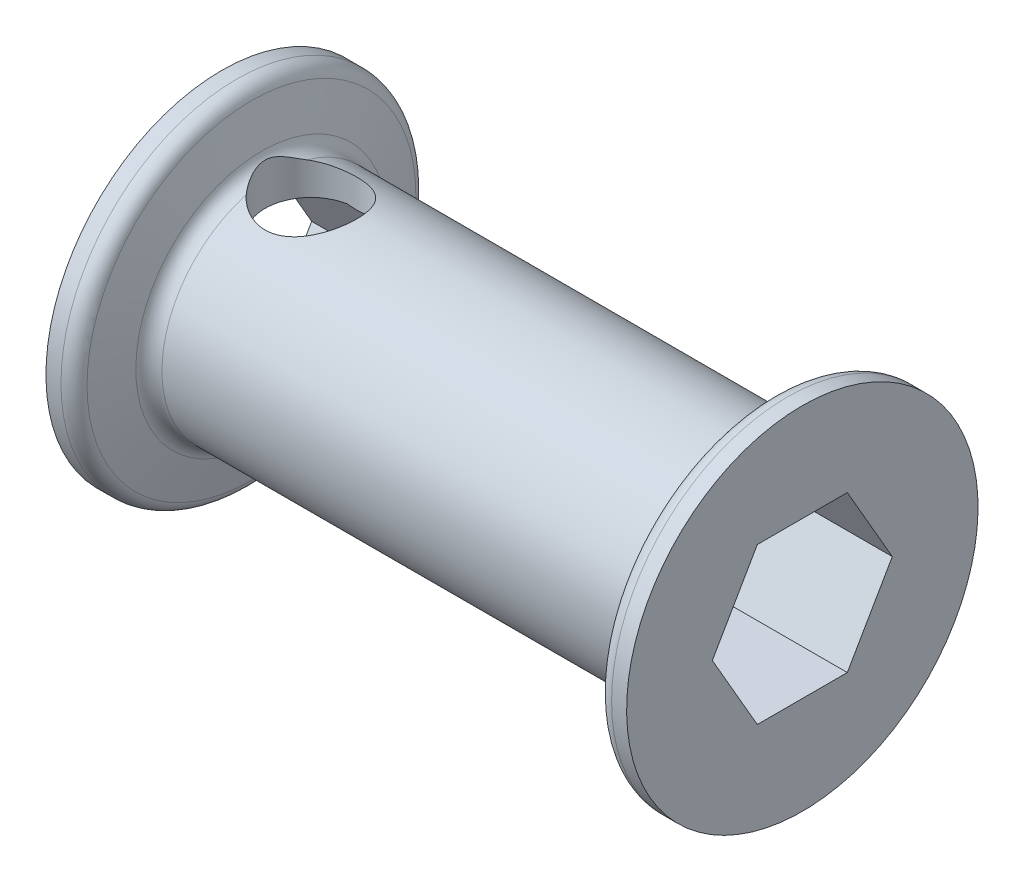
from build123d import *

# Parameters (mm, degrees)
CUT_EXTRUDE1_DEPTH = 53.494186821
FILLET1_R          = 1.27


with BuildPart() as part:
    # Sketch1 → Revolve1 (revolve)
    with BuildSketch(Plane.XY):
        Polygon((0, 0), (48.26, 0), (48.26, 14.605), (46.0375, 14.605), (44.676318102, 9.525), (3.583681898, 9.525), (2.2225, 14.605), (0, 14.605), align=None)
    revolve(axis=Axis((48.26, 0, 0), (-1, 0, 0)))

    # Sketch2 → Cut-Extrude1 (cut, through all)
    with BuildSketch(Plane.ZY):
        Polygon((7.478995387, 0), (3.739497694, 6.477), (-3.739497694, 6.477), (-7.478995387, 0), (-3.739497694, -6.477), (3.739497694, -6.477), align=None)
    extrude(amount=-CUT_EXTRUDE1_DEPTH, mode=Mode.SUBTRACT)

    # Fillet1
    fillet1_edges = [part.edges().sort_by_distance(p)[0] for p in [
        (3.583681898, -9.525, 0),
        (2.2225, -14.605, 0),
        (46.0375, -14.605, 0),
        (44.676318102, -9.525, 0),
    ]]
    fillet(fillet1_edges, radius=FILLET1_R)

    # Sketch3 → Cut-Revolve1 (revolve, cut)
    with BuildSketch(Plane.XY):
        Polygon((9.3206824, -14.605), (7.4156824, -14.605), (7.4156824, 14.605), (11.2256824, 14.605), (11.2256824, -0.025313637), (9.3206824, -0.025313637), align=None)
    revolve(axis=Axis((7.4156824, 14.605, 0), (0, 1, 0)), mode=Mode.SUBTRACT)


solid = part.part
